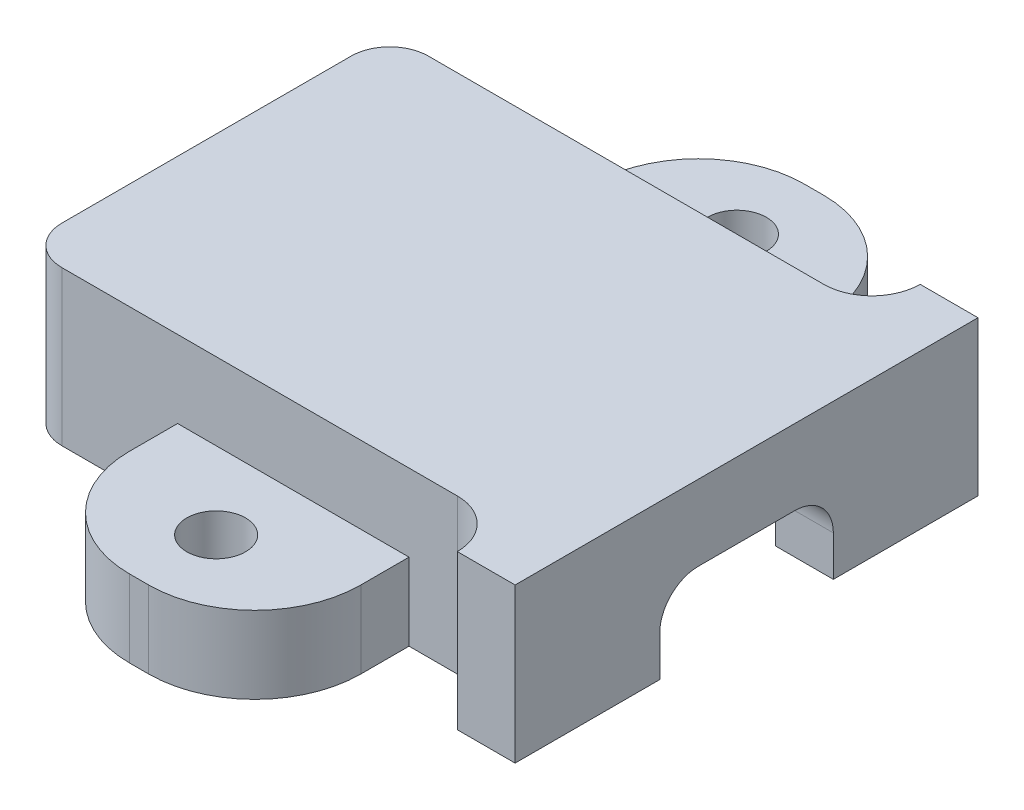
from build123d import *

# Parameters (mm, degrees)
SKETCH1_W           = 22
SKETCH1_H           = 13
BOSS_EXTRUDE1_DEPTH = 6
BOSS_EXTRUDE2_DEPTH = 2
BOSS_EXTRUDE3_DEPTH = 8
SKETCH4_R           = 1.525
SKETCH4_R_2         = 1.524
CUT_EXTRUDE1_DEPTH  = 36.566838488
SKETCH5_W           = 9
SKETCH5_H           = 4.088652256
CUT_EXTRUDE2_DEPTH  = 38.735924528
FILLET1_R           = 2
SKETCH6_W           = 12
SKETCH6_H           = 13.009000019
SKETCH6_W_2         = 15.838286437
CUT_EXTRUDE3_DEPTH  = 4
SKETCH7_W           = 2.5
SKETCH7_H           = 8
BOSS_EXTRUDE5_DEPTH = 3
FILLET3_R           = 2.5
FILLET4_R           = 2.5


with BuildPart() as part:
    # Sketch1 → Boss-Extrude1 (new body)
    with BuildSketch(Plane(origin=(0, 0, 0), x_dir=(1, 0, 0), z_dir=(0, 1, 0))):
        with BuildLine():
            Line((-1, -3), (23, -3))
            Line((23, -3), (25, -3))
            Line((25, -3), (25, -1))
            Line((25, -1), (25, 14))
            Line((25, 14), (25, 16))
            Line((25, 16), (23, 16))
            Line((23, 16), (-1, 16))
            ThreePointArc((-1, 16), (-2.414213562, 15.414213562), (-3, 14))
            Line((-3, 14), (-3, -1))
            ThreePointArc((-3, -1), (-2.414213562, -2.414213562), (-1, -3))
        make_face()
        with Locations((11, 6.5)):
            Rectangle(SKETCH1_W, SKETCH1_H, mode=Mode.SUBTRACT)
    extrude(amount=BOSS_EXTRUDE1_DEPTH)

    # Sketch2 → Boss-Extrude2 (add)
    with BuildSketch(Plane(origin=(0, 6, 0), x_dir=(1, 0, 0), z_dir=(0, 1, 0))):
        with BuildLine():
            Line((25, 14), (25, -1))
            Line((25, -1), (25, -3))
            Line((25, -3), (23, -3))
            Line((23, -3), (-1, -3))
            ThreePointArc((-1, -3), (-2.414213562, -2.414213562), (-3, -1))
            Line((-3, -1), (-3, 14))
            ThreePointArc((-3, 14), (-2.414213562, 15.414213562), (-1, 16))
            Line((-1, 16), (23, 16))
            Line((23, 16), (25, 16))
            Line((25, 16), (25, 14))
        make_face()
    extrude(amount=BOSS_EXTRUDE2_DEPTH)

    # Sketch3 → Boss-Extrude3 (add)
    with BuildSketch(Plane.XZ):
        with BuildLine():
            Line((5, 3), (17, 3))
            Line((17, 3), (17, 5.5))
            ThreePointArc((17, 5.5), (15.389087297, 9.389087297), (11.5, 11))
            Line((11.5, 11), (10.5, 11))
            ThreePointArc((10.5, 11), (6.610912703, 9.389087297), (5, 5.5))
            Line((5, 5.5), (5, 3))
        make_face()
        with BuildLine():
            Line((17, -16), (5, -16))
            Line((5, -16), (5, -18.5))
            ThreePointArc((5, -18.5), (6.610912703, -22.389087297), (10.5, -24))
            Line((10.5, -24), (11.5, -24))
            ThreePointArc((11.5, -24), (15.389087297, -22.389087297), (17, -18.5))
            Line((17, -18.5), (17, -16))
        make_face()
    extrude(amount=-BOSS_EXTRUDE3_DEPTH)

    # Sketch4 → Cut-Extrude1 (cut, through all)
    with BuildSketch(Plane(origin=(0, 0, 0), x_dir=(-1, 0, 0), z_dir=(0, -1, 0))):
        with Locations(Location((-11, 20, 0), (0, 0, 90))):
            Circle(SKETCH4_R)
        with Locations(Location((-11, -7, 0), (0, 0, 90))):
            Circle(SKETCH4_R_2)
    extrude(amount=-CUT_EXTRUDE1_DEPTH, mode=Mode.SUBTRACT)

    # Sketch5 → Cut-Extrude2 (cut, through all)
    with BuildSketch(Plane(origin=(25, 0, 0), x_dir=(0, 0, -1), z_dir=(1, 0, 0))):
        with Locations((6.5, 2.044326128)):
            Rectangle(SKETCH5_W, SKETCH5_H)
    extrude(amount=-CUT_EXTRUDE2_DEPTH, mode=Mode.SUBTRACT)

    # Fillet1
    fillet1_edges = [part.edges().sort_by_distance(p)[0] for p in [
        (-1.5, 4.088652256, -11),
        (-1.5, 4.088652256, -2),
        (23.5, 4.088652256, -11),
        (23.5, 4.088652256, -2),
    ]]
    fillet(fillet1_edges, radius=FILLET1_R)

    # Sketch6 → Cut-Extrude3 (cut)
    with BuildSketch(Plane(origin=(0, 8, 0), x_dir=(1, 0, 0), z_dir=(0, 1, 0))):
        with Locations((11, 22.504500009)):
            Rectangle(SKETCH6_W, SKETCH6_H)
        with Locations((11.149066226, -9.50450001)):
            Rectangle(SKETCH6_W_2, SKETCH6_H)
    extrude(amount=-CUT_EXTRUDE3_DEPTH, mode=Mode.SUBTRACT)

    # Sketch7 → Boss-Extrude5 (add)
    with BuildSketch(Plane(origin=(25, 0, 0), x_dir=(0, 0, -1), z_dir=(1, 0, 0))):
        with Locations((17.25, 4)):
            Rectangle(SKETCH7_W, SKETCH7_H)
        with Locations((-4.25, 4)):
            Rectangle(SKETCH7_W, SKETCH7_H)
    extrude(amount=-BOSS_EXTRUDE5_DEPTH)

    # Fillet3
    fillet3_edges = [part.edges().sort_by_distance(p)[0] for p in [
        (22, 4, -16),
    ]]
    fillet(fillet3_edges, radius=FILLET3_R - 0.0001)  # a hair under: the kernel refuses the full size

    # Fillet4
    fillet4_edges = [part.edges().sort_by_distance(p)[0] for p in [
        (22, 4, 3),
    ]]
    fillet(fillet4_edges, radius=FILLET4_R - 0.0001)  # a hair under: the kernel refuses the full size


solid = part.part
